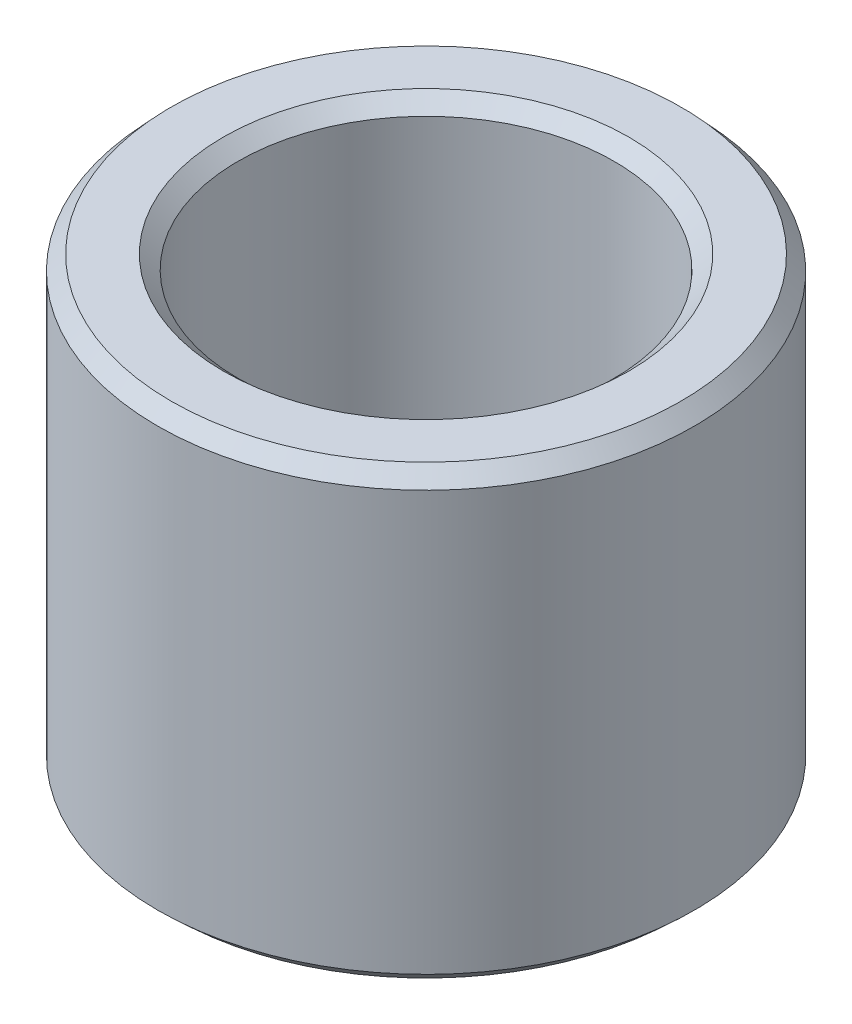
from build123d import *
from OCP.BRepFilletAPI import BRepFilletAPI_MakeChamfer

# Parameters (mm, degrees)
SKETCH1_R           = 60
BOSS_EXTRUDE1_DEPTH = 100.026628009
SKETCH2_R           = 42.025881276
CUT_EXTRUDE1_DEPTH  = 132.169075284
CHAMFER1_SIZE       = 3.288773415
CHAMFER1_SIZE2      = 3.040054255


with BuildPart() as part:
    # Sketch1 → Boss-Extrude1 (new body)
    with BuildSketch(Plane(origin=(0, 0, 0), x_dir=(1, 0, 0), z_dir=(0, 1, 0))):
        Circle(SKETCH1_R)
    extrude(amount=BOSS_EXTRUDE1_DEPTH)

    # Sketch2 → Cut-Extrude1 (cut, through all)
    with BuildSketch(Plane(origin=(0, 0, 0), x_dir=(1, 0, 0), z_dir=(0, 1, 0))):
        Circle(SKETCH2_R)
    extrude(amount=CUT_EXTRUDE1_DEPTH, mode=Mode.SUBTRACT)

    # Chamfer1: one chamfer whose edges measure the first distance from different faces: ONE call of the kernel's chamfer builder (chamfer() names one face for all edges)
    chamfer1_edges_1 = [part.edges().sort_by_distance(p)[0] for p in [
        (-42.025881276, 100.026628009, 0),
    ]]
    chamfer1_side_1 = [part.faces().sort_by_distance(p)[0] for p in [
        (-58.302943725, 100.026628009, 0),
    ]]
    chamfer1_edges_2 = [part.edges().sort_by_distance(p)[0] for p in [
        (-42.025881276, 0, 0),
    ]]
    chamfer1_side_2 = [part.faces().sort_by_distance(p)[0] for p in [
        (-42.025881276, 50.013314004, 0),
    ]]
    chamfer1_edges_3 = [part.edges().sort_by_distance(p)[0] for p in [
        (-60, 0, 0),
    ]]
    chamfer1_side_3 = [part.faces().sort_by_distance(p)[0] for p in [
        (-58.302943725, 0, 0),
    ]]
    chamfer1_edges_4 = [part.edges().sort_by_distance(p)[0] for p in [
        (-60, 100.026628009, 0),
    ]]
    chamfer1_side_4 = [part.faces().sort_by_distance(p)[0] for p in [
        (-60, 50.013314004, 0),
    ]]
    chamfer1 = BRepFilletAPI_MakeChamfer(part.part.solid().wrapped)
    for e in chamfer1_edges_1:
        chamfer1.Add(CHAMFER1_SIZE, CHAMFER1_SIZE2, e.wrapped, chamfer1_side_1[0].wrapped)  # the first distance lies on this face
    for e in chamfer1_edges_2:
        chamfer1.Add(CHAMFER1_SIZE, CHAMFER1_SIZE2, e.wrapped, chamfer1_side_2[0].wrapped)  # the first distance lies on this face
    for e in chamfer1_edges_3:
        chamfer1.Add(CHAMFER1_SIZE, CHAMFER1_SIZE2, e.wrapped, chamfer1_side_3[0].wrapped)  # the first distance lies on this face
    for e in chamfer1_edges_4:
        chamfer1.Add(CHAMFER1_SIZE, CHAMFER1_SIZE2, e.wrapped, chamfer1_side_4[0].wrapped)  # the first distance lies on this face
    add(Compound.cast(chamfer1.Shape()), mode=Mode.REPLACE)


solid = part.part
